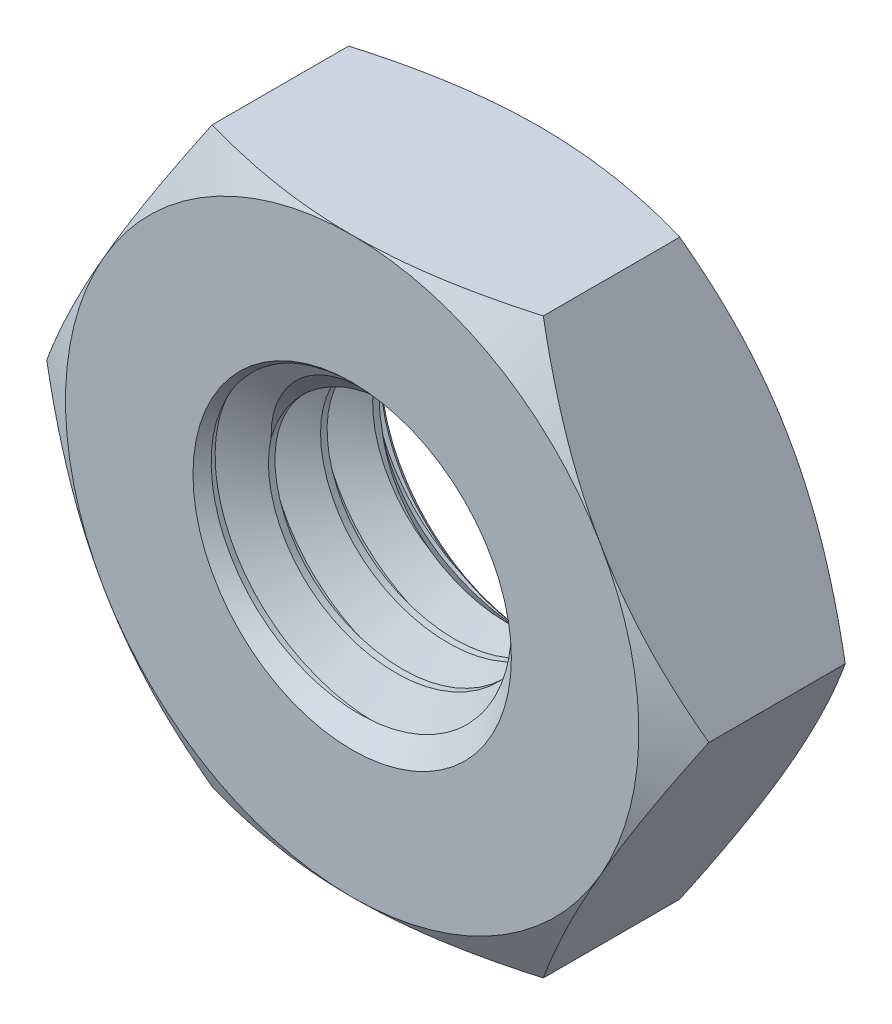
from build123d import *
from build123d.topology import SkipClean

# Parameters (mm, degrees)
BOSS_EXTRUDE1_DEPTH      = 0.9
BOSS_EXTRUDE1_DEPTH_BACK = 0.9
SKETCH2_R                = 1.5
SKETCH3_OUTSIDE_W        = 44.71
SKETCH3_OUTSIDE_H        = 43.86
SKETCH3_OUTSIDE_R        = 2.75
CUT_EXTRUDE1_DEPTH       = 10
CUT_EXTRUDE1_DRAFT       = -60
SKETCH4_OUTSIDE_W        = 29.364
SKETCH4_OUTSIDE_H        = 28.514
SKETCH4_OUTSIDE_R        = 2.75
CUT_EXTRUDE2_DEPTH       = 5.570102114
CUT_EXTRUDE2_DRAFT       = -60
SWEEP2_PITCH             = 0.5


with BuildPart() as part:
    # Sketch2 → Boss-Extrude1 (new, two sides: drawn at the far end of the back side and taken through both)
    with BuildSketch(Plane.XY.offset(-BOSS_EXTRUDE1_DEPTH_BACK)):
        Polygon((-1.58771324, 2.75), (-3.175426481, 0), (-1.58771324, -2.75), (1.58771324, -2.75), (3.175426481, 0), (1.58771324, 2.75), align=None)
        Circle(SKETCH2_R, mode=Mode.SUBTRACT)
    extrude(amount=BOSS_EXTRUDE1_DEPTH + BOSS_EXTRUDE1_DEPTH_BACK)


with BuildPart() as cut_extrude1_tool:
    # Sketch3 outside → Cut-Extrude1 (with draft: the straight prism first)
    with BuildSketch(Plane.XY.offset(0.9)):
        Rectangle(SKETCH3_OUTSIDE_W, SKETCH3_OUTSIDE_H)
        Circle(SKETCH3_OUTSIDE_R, mode=Mode.SUBTRACT)
    extrude(amount=-CUT_EXTRUDE1_DEPTH)
    # Cut-Extrude1: the draft: its side faces are tilted about the plane it starts from
    cut_extrude1_sides = [cut_extrude1_tool.faces().sort_by_distance(p)[0] for p in [
        (0, -21.93, -4.1),
        (22.355, 0, -4.1),
        (0, 21.93, -4.1),
        (-22.355, 0, -4.1),
        (-2.75, 0, -4.1),
    ]]
    draft(cut_extrude1_sides, Plane.XY.offset(0.9), CUT_EXTRUDE1_DRAFT)


with BuildPart() as part_1:
    add(part.part)

    # Cut-Extrude1: cut by cut_extrude1_tool
    add(cut_extrude1_tool.part, mode=Mode.SUBTRACT)


with BuildPart() as cut_extrude2_tool:
    # Sketch4 outside → Cut-Extrude2 (with draft: the straight prism first)
    with BuildSketch(Plane(origin=(0, 0, -0.9), x_dir=(-1, 0, 0), z_dir=(0, 0, -1))):
        Rectangle(SKETCH4_OUTSIDE_W, SKETCH4_OUTSIDE_H)
        Circle(SKETCH4_OUTSIDE_R, mode=Mode.SUBTRACT)
    extrude(amount=-CUT_EXTRUDE2_DEPTH)
    # Cut-Extrude2: the draft: its side faces are tilted about the plane it starts from
    cut_extrude2_sides = [cut_extrude2_tool.faces().sort_by_distance(p)[0] for p in [
        (0, -14.257, 1.885051057),
        (-14.682, 0, 1.885051057),
        (0, 14.257, 1.885051057),
        (14.682, 0, 1.885051057),
        (2.75, 0, 1.885051057),
    ]]
    draft(cut_extrude2_sides, Plane(origin=(0, 0, -0.9), x_dir=(-1, 0, 0), z_dir=(0, 0, -1)), CUT_EXTRUDE2_DRAFT)


with BuildPart() as part_2:
    add(part_1.part)

    # Cut-Extrude2: cut by cut_extrude2_tool
    add(cut_extrude2_tool.part, mode=Mode.SUBTRACT)

    # Sketch8 → Cut-Revolve2 (revolve, cut)
    with BuildSketch(Plane(origin=(0, 0, 0), x_dir=(0, 0, -1), z_dir=(1, 0, 0))):
        Polygon((-1.36875, 1.995813294), (0, 0.627063294), (1.36875, 1.995813294), (1.36875, 0), (-1.36875, 0), align=None)
    revolve(axis=Axis((0, 0, 0.9), (0, 0, -1)), mode=Mode.SUBTRACT)

    # Sweep2: the profile of Sketch5 screwed along a left-hand helix of 4.6 turns, 6 arcs to a turn; built about Z, then put on its axis
    with SkipClean():  # the faces are left unmerged after this step: merging them gives an invalid solid
        sweep2_z = Axis((0, 0, 0), (0, 0, 1))
        sweep2_corners = [(1.527063294, 0, -0.453125), (1.527063294, 0, 0.015625), (1.175240474, 0, -0.1875), (1.175240474, 0, -0.25)]
        with BuildLine(mode=Mode.PRIVATE) as sweep2_profile:
            Line(sweep2_corners[0], sweep2_corners[1])
            Line(sweep2_corners[1], sweep2_corners[2])
            Line(sweep2_corners[2], sweep2_corners[3])
            Line(sweep2_corners[3], sweep2_corners[0])
        sweep2_cap = Face(sweep2_profile.wire())
        sweep2_turn_angles = [0, -30, -60, -90, -120, -150, -180, -210, -240, -270, -300, -330, -360]
        sweep2_turn_weights = [1, 0.8660254037844387, 1, 0.8660254037844387, 1, 0.8660254037844387, 1, 0.8660254037844387, 1, 0.8660254037844387, 1, 0.8660254037844387, 1]
        sweep2_turn_rails = [Edge.make_bspline([Vector(p[0], p[1], 0).rotate(sweep2_z, sweep2_turn_angles[k]) / sweep2_turn_weights[k] + Vector(0, 0, p[2] + -SWEEP2_PITCH * sweep2_turn_angles[k] / 360) for k in range(13)], [0, 0, 0, 1, 1, 2, 2, 3, 3, 4, 4, 5, 5, 6, 6, 6], 2, sweep2_turn_weights) for p in sweep2_corners]
        sweep2_turn_sides = [Face.make_surface_from_curves(sweep2_turn_rails[p[0]], sweep2_turn_rails[p[1]]) for p in [(0, 1), (1, 2), (2, 3), (3, 0)]]
        sweep2_last_angles = [-1440, -1470, -1500, -1530, -1560, -1590, -1620, -1638, -1656]
        sweep2_last_weights = [1, 0.8660254037844387, 1, 0.8660254037844387, 1, 0.8660254037844387, 1, 0.9510565162951554, 1]
        sweep2_last_rails = [Edge.make_bspline([Vector(p[0], p[1], 0).rotate(sweep2_z, sweep2_last_angles[k]) / sweep2_last_weights[k] + Vector(0, 0, p[2] + -SWEEP2_PITCH * sweep2_last_angles[k] / 360) for k in range(9)], [0, 0, 0, 1, 1, 2, 2, 3, 3, 4, 4, 4], 2, sweep2_last_weights) for p in sweep2_corners]
        sweep2_last_sides = [Face.make_surface_from_curves(sweep2_last_rails[p[0]], sweep2_last_rails[p[1]]) for p in [(0, 1), (1, 2), (2, 3), (3, 0)]]
        sweep2 = Plane(origin=(0, 0, 0.9), x_dir=(0, 1, 0), z_dir=(0, 0, -1)) * Solid(Shell([*[p.moved(Location((0, 0, SWEEP2_PITCH * i))) for i in range(4) for p in sweep2_turn_sides], *sweep2_last_sides, sweep2_cap, sweep2_cap.rotate(sweep2_z, -1656).moved(Location((0, 0, -SWEEP2_PITCH * -1656 / 360)))]))
        add(sweep2)
    add(part_2.part.scale(1), mode=Mode.REPLACE)  # the faces are merged on a copy

    # Sketch7 → Cut-Revolve1 (revolve, cut)
    with BuildSketch(Plane(origin=(0, 0, 0), x_dir=(0, 0, -1), z_dir=(1, 0, 0)), mode=Mode.PRIVATE) as cut_revolve1_sk:
        Polygon((-1.65, 2.277063294), (0, 0.627063294), (1.65, 2.277063294), (1.65, 0), (-1.65, 0), align=None)
    revolve(cut_revolve1_sk.sketch.rotate(Axis((0, 0, 0.9), (0, 0, -1)), 90), axis=Axis((0, 0, 0.9), (0, 0, -1)), mode=Mode.SUBTRACT)


solid = part_2.part
